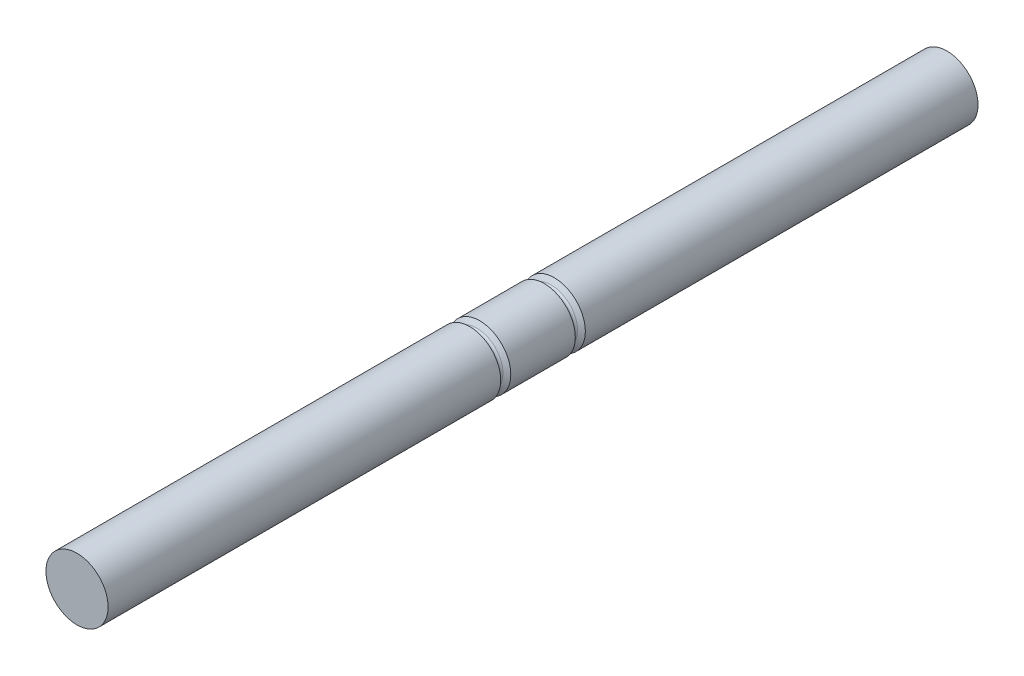
from build123d import *

# Parameters (mm, degrees)
SKETCH1_R  = 1.5875
BODY_DEPTH = 44.45


with BuildPart() as part:
    # Sketch1 → Body (new body)
    with BuildSketch(Plane.XY):
        Circle(SKETCH1_R)
    extrude(amount=-BODY_DEPTH)

    # Sketch2 → WireSlots (revolve, cut)
    with BuildSketch(Plane(origin=(0, 0, 0), x_dir=(1, 0, 0), z_dir=(0, 1, 0))):
        with BuildLine():
            Line((-2.242852263, 19.685), (-2.242852263, 20.955))
            Line((-2.242852263, 20.955), (-1.3335, 20.429985226))
            ThreePointArc((-1.3335, 20.429985226), (-1.27, 20.32), (-1.3335, 20.210014774))
            Line((-1.3335, 20.210014774), (-2.242852263, 19.685))
        make_face()
        with BuildLine():
            Line((-2.242852263, 23.495), (-1.3335, 24.020014774))
            ThreePointArc((-1.3335, 24.020014774), (-1.27, 24.13), (-1.3335, 24.239985226))
            Line((-1.3335, 24.239985226), (-2.242852263, 24.765))
            Line((-2.242852263, 24.765), (-2.242852263, 23.495))
        make_face()
    revolve(axis=Axis((0, 0, 0), (0, 0, -1)), mode=Mode.SUBTRACT)


solid = part.part
